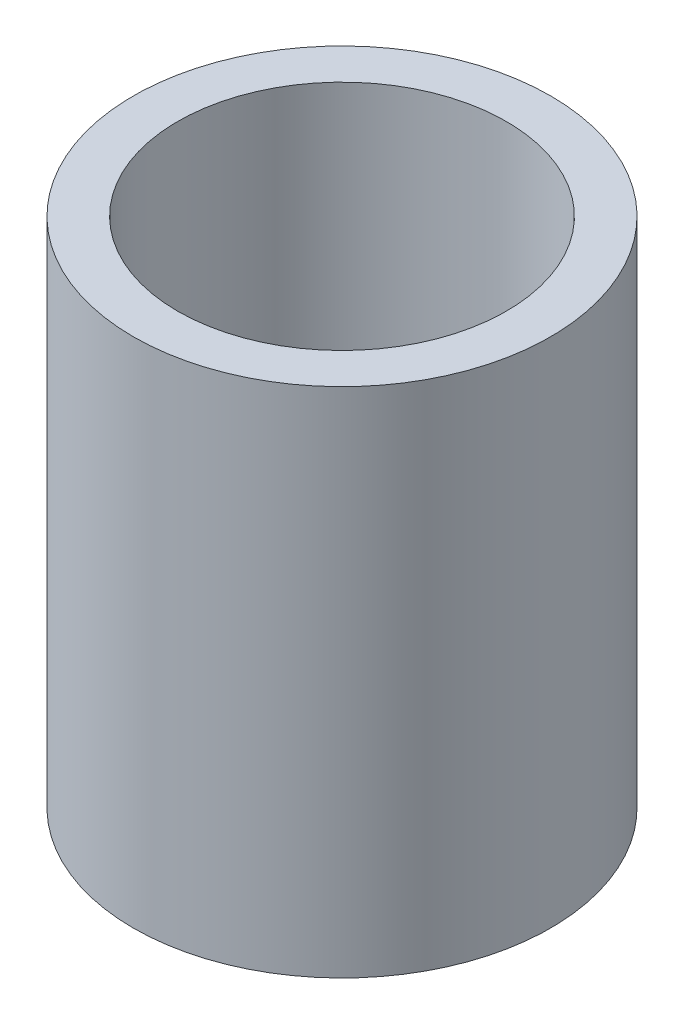
from build123d import *

# Parameters (mm, degrees)
SKETCH1_R           = 17.5
BOSS_EXTRUDE1_DEPTH = 42.956380437
SKETCH2_R           = 13.785041232
CUT_EXTRUDE1_DEPTH  = 50.575705948


with BuildPart() as part:
    # Sketch1 → Boss-Extrude1 (new body)
    with BuildSketch(Plane(origin=(0, 0, 0), x_dir=(1, 0, 0), z_dir=(0, 1, 0))):
        Circle(SKETCH1_R)
    extrude(amount=BOSS_EXTRUDE1_DEPTH)

    # Sketch2 → Cut-Extrude1 (cut, through all)
    with BuildSketch(Plane(origin=(0, 0, 0), x_dir=(1, 0, 0), z_dir=(0, 1, 0))):
        Circle(SKETCH2_R)
    extrude(amount=CUT_EXTRUDE1_DEPTH, mode=Mode.SUBTRACT)


solid = part.part
